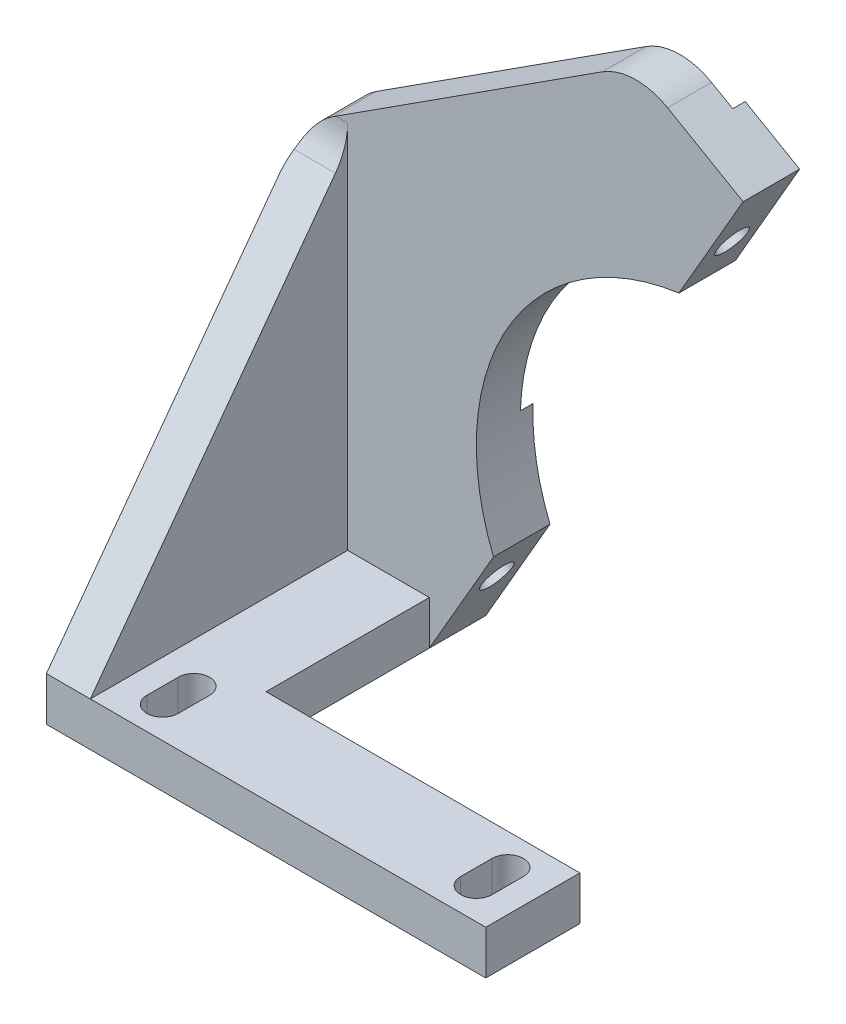
from build123d import *

# Parameters (mm, degrees)
BOSS_EXTRUDE1_DEPTH             = 7
BOSS_EXTRUDE3_DEPTH             = 2
TAP_DRILL_FOR_M6X1_0_TAP1_D     = 5
TAP_DRILL_FOR_M6X1_0_TAP1_DEPTH = 8
TAP_DRILL_FOR_M6X1_0_TAP1_TIP   = 1.502151548
BOSS_EXTRUDE4_DEPTH             = 7
BOSS_EXTRUDE5_DEPTH             = 7
CUT_EXTRUDE1_DEPTH              = 116.367305777
FILLET2_R                       = 10


with BuildPart() as part:
    # Sketch1 → Boss-Extrude1 (new body)
    with BuildSketch(Plane.XY):
        with BuildLine():
            Line((49.772581584, 68.888132052), (60, 86.602540378))
            Line((60, 86.602540378), (42.679491924, 96.602540378))
            Line((42.679491924, 96.602540378), (-10, 62.664913519))
            Line((-10, 62.664913519), (-10, 0))
            Line((-10, 0), (10, 0))
            Line((10, 0), (20.227418416, 17.714408326))
            ThreePointArc((20.227418416, 17.714408326), (22.524047358, 50.504264805), (49.772581584, 68.888132052))
        make_face()
    extrude(amount=-BOSS_EXTRUDE1_DEPTH)

    # Sketch5 → Boss-Extrude3 (add)
    with BuildSketch(Plane(origin=(0, 0, -7), x_dir=(-1, 0, 0), z_dir=(0, 0, -1))):
        with BuildLine():
            Line((-51.339745962, 91.602540378), (-60, 86.602540378))
            Line((-60, 86.602540378), (-49.772581584, 68.888132052))
            ThreePointArc((-49.772581584, 68.888132052), (-42.186769591, 66.997294279), (-35.157858732, 63.574689534))
            Line((-35.157858732, 63.574689534), (-51.339745962, 91.602540378))
        make_face()
        with BuildLine():
            ThreePointArc((-17.521633192, 33.027850844), (-18.072025965, 25.229333108), (-20.227418416, 17.714408326))
            Line((-20.227418416, 17.714408326), (-10, 0))
            Line((-10, 0), (1.547005384, 0))
            Line((1.547005384, 0), (-17.521633192, 33.027850844))
        make_face()
    extrude(amount=BOSS_EXTRUDE3_DEPTH)

    # Tap Drill for M6x1.0 Tap1
    with Locations(Plane(origin=(7.5, -4.330127019, 0), x_dir=(0, 0, -1), z_dir=(0.8660254037844368, -0.5000000000000031, 0))):
        with Locations((4.5, 92.5), (4.5, 17.5)):
            Hole(TAP_DRILL_FOR_M6X1_0_TAP1_D / 2, depth=TAP_DRILL_FOR_M6X1_0_TAP1_DEPTH)
            with Locations((0, 0, -(TAP_DRILL_FOR_M6X1_0_TAP1_DEPTH + TAP_DRILL_FOR_M6X1_0_TAP1_TIP / 2))):  # 118° drill point
                Cone(0, TAP_DRILL_FOR_M6X1_0_TAP1_D / 2, TAP_DRILL_FOR_M6X1_0_TAP1_TIP, mode=Mode.SUBTRACT)

    # Sketch9 → Boss-Extrude4 (add)
    with BuildSketch(Plane(origin=(0, 0, 0), x_dir=(1, 0, 0), z_dir=(0, 1, 0))):
        Polygon((-10, 0), (-10, -41), (60, -41), (60, -26), (10, -26), (10, 0), align=None)
    extrude(amount=BOSS_EXTRUDE4_DEPTH)

    # Sketch10 → Boss-Extrude5 (add)
    with BuildSketch(Plane.ZY.offset(10)):
        Polygon((0, 62.664913519), (41, 7), (0, 7), align=None)
    extrude(amount=-BOSS_EXTRUDE5_DEPTH)

    # Sketch11 → Cut-Extrude1 (cut, through all)
    with BuildSketch(Plane(origin=(0, 7, 0), x_dir=(1, 0, 0), z_dir=(0, 1, 0))):
        with BuildLine():
            ThreePointArc((1, -36), (3.5, -38.5), (6, -36))
            Line((6, -36), (6, -31))
            ThreePointArc((6, -31), (3.5, -28.5), (1, -31))
            Line((1, -31), (1, -36))
        make_face()
        with BuildLine():
            Line((51, -31), (51, -36))
            ThreePointArc((51, -36), (53.5, -38.5), (56, -36))
            Line((56, -36), (56, -31))
            ThreePointArc((56, -31), (53.5, -28.5), (51, -31))
        make_face()
    extrude(amount=-CUT_EXTRUDE1_DEPTH, mode=Mode.SUBTRACT)

    # Fillet2
    fillet2_edges = [part.edges().sort_by_distance(p)[0] for p in [
        (-6.5, 62.664913519, 0),
    ]]
    fillet(fillet2_edges, radius=FILLET2_R)
    fillet2_2_edges = [part.edges().sort_by_distance(p)[0] for p in [
        (-10, 62.664913519, -3.222472691),
        (42.679491924, 96.602540378, -3.5),
    ]]
    fillet(fillet2_2_edges, radius=FILLET2_R)


solid = part.part
